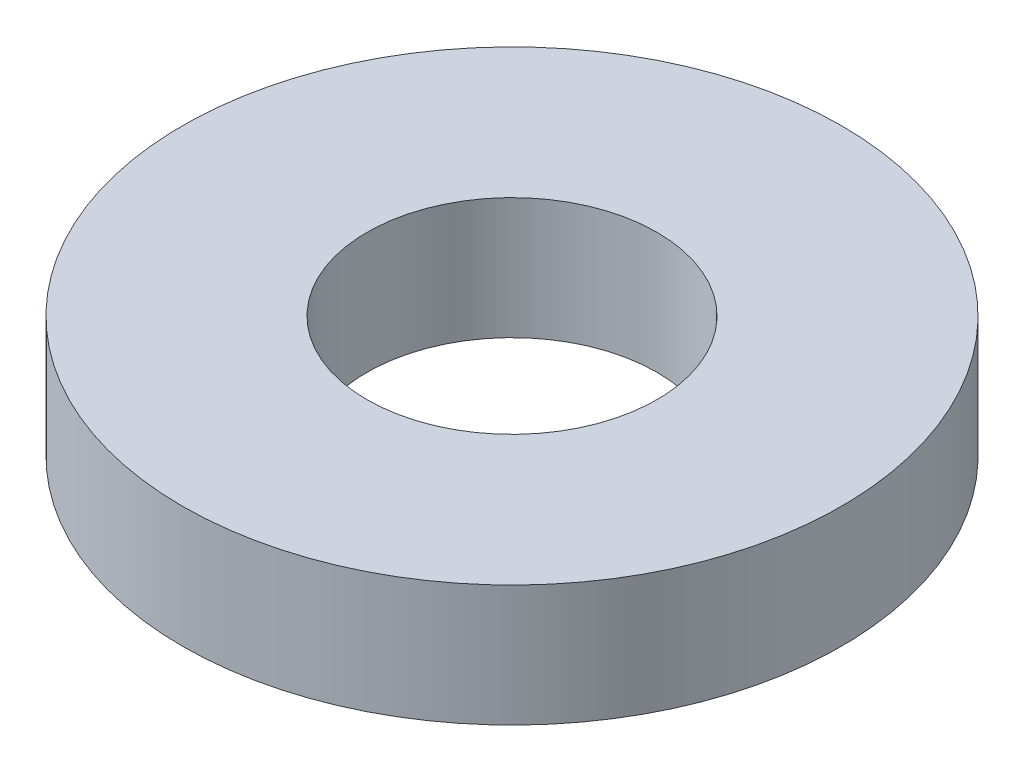
from build123d import *

# Parameters (mm, degrees)
SKETCH1_R           = 62.5
BOSS_EXTRUDE1_DEPTH = 23
SKETCH2_R           = 27.5
CUT_EXTRUDE1_DEPTH  = 92.331812639


with BuildPart() as part:
    # Sketch1 → Boss-Extrude1 (new body)
    with BuildSketch(Plane(origin=(0, 0, 0), x_dir=(1, 0, 0), z_dir=(0, 1, 0))):
        Circle(SKETCH1_R)
    extrude(amount=BOSS_EXTRUDE1_DEPTH)

    # Sketch2 → Cut-Extrude1 (cut, through all)
    with BuildSketch(Plane(origin=(0, 0, 0), x_dir=(1, 0, 0), z_dir=(0, 1, 0))):
        Circle(SKETCH2_R)
    extrude(amount=CUT_EXTRUDE1_DEPTH, mode=Mode.SUBTRACT)


solid = part.part
